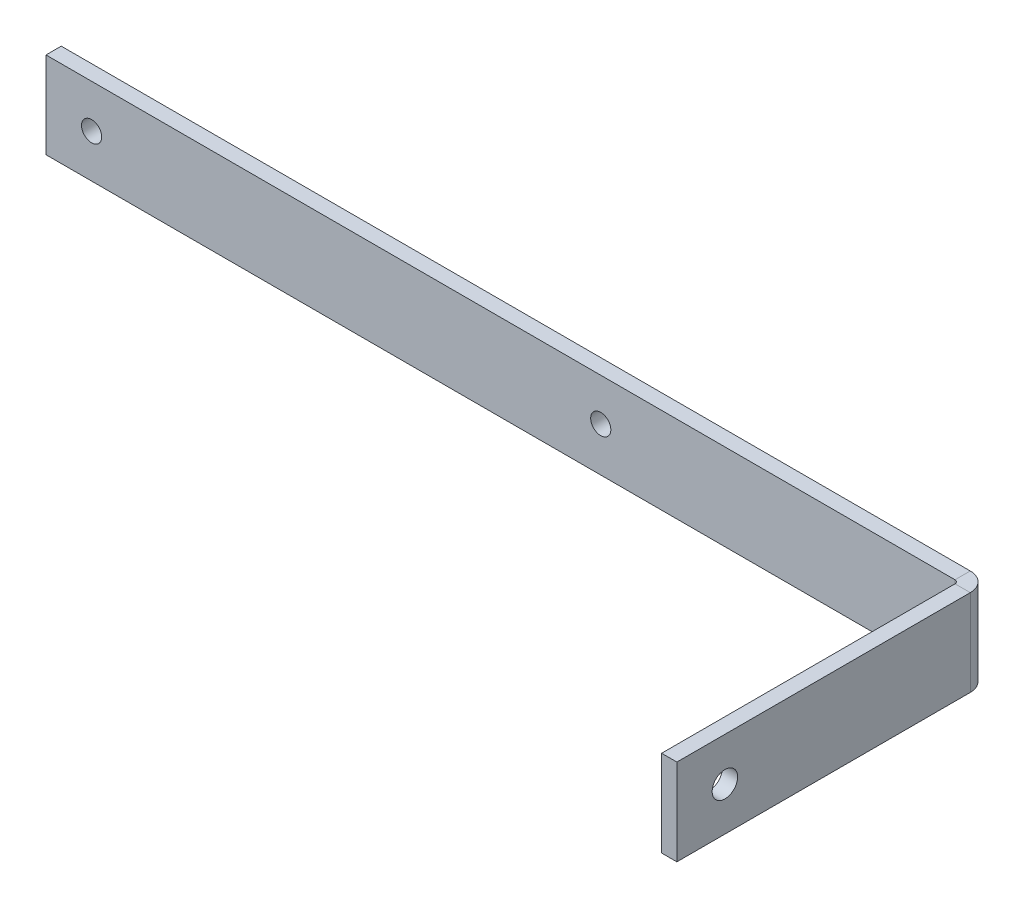
from build123d import *

# Parameters (mm, degrees)
SKETCH7_W                    = 190
SKETCH7_H                    = 18
BASE_FLANGE2_DEPTH           = 3.175
EDGE_FLANGE1_STRIP_W         = 14.1732
EDGE_FLANGE1_STRIP_H         = 3.175
EDGE_FLANGE1_STRIP_CUT_DEPTH = 18
EDGE_FLANGE1_DEPTH           = 18
M5X0_8_TAPPED_HOLE2_D        = 4.2
HOLE1_START                  = 190
HOLE1_OUTLINE_R              = 2.65
HOLE1_DEPTH                  = 3.175


# Read off the part's stored shape, not the designer's step: Hole1
# Sheet-metal steps are written as plain solids
with BuildPart() as part:
    # Sketch7 → Base-Flange2 (new body)
    with BuildSketch(Plane.XY):
        with Locations((95, 9)):
            Rectangle(SKETCH7_W, SKETCH7_H)
    extrude(amount=-BASE_FLANGE2_DEPTH)

    # Edge-Flange1 strip (across the edge) → Edge-Flange1 strip cut (cut)
    with BuildSketch(Plane(origin=(190, 0, 0), x_dir=(-1, 0, 0), z_dir=(0, 1, 0))):
        with Locations((-6.35, -1.5875)):
            Rectangle(EDGE_FLANGE1_STRIP_W, EDGE_FLANGE1_STRIP_H)
    extrude(amount=EDGE_FLANGE1_STRIP_CUT_DEPTH, mode=Mode.SUBTRACT)

    # Edge-Flange1 section (across the edge) → Edge-Flange1 (add)
    with BuildSketch(Plane(origin=(190, 0, 0), x_dir=(-1, 0, 0), z_dir=(0, 1, 0))):
        with BuildLine():
            Line((-3.175, 0.7366), (-3.175, 61.825))
            Line((-3.175, 61.825), (0, 61.825))
            Line((0, 61.825), (0, 0.7366))
            ThreePointArc((0, 0.7366), (0.215745145, 0.215745145), (0.7366, 0))
            Line((0.7366, 0), (0.7366, -3.175))
            ThreePointArc((0.7366, -3.175), (-2.029318885, -2.029318885), (-3.175, 0.7366))
        make_face()
    extrude(amount=EDGE_FLANGE1_DEPTH)

    # M5x0.8 Tapped Hole2 (through all)
    with Locations(Plane.XY):
        with Locations((9.5, 9), (115.5, 9.202035326)):
            Hole(M5X0_8_TAPPED_HOLE2_D / 2)

    # Hole1 outline → Hole1 (cut)
    with BuildSketch(Plane.YZ.offset(HOLE1_START)):
        with Locations((9, 51.825)):
            Circle(HOLE1_OUTLINE_R)
    extrude(amount=HOLE1_DEPTH, mode=Mode.SUBTRACT)


solid = part.part
